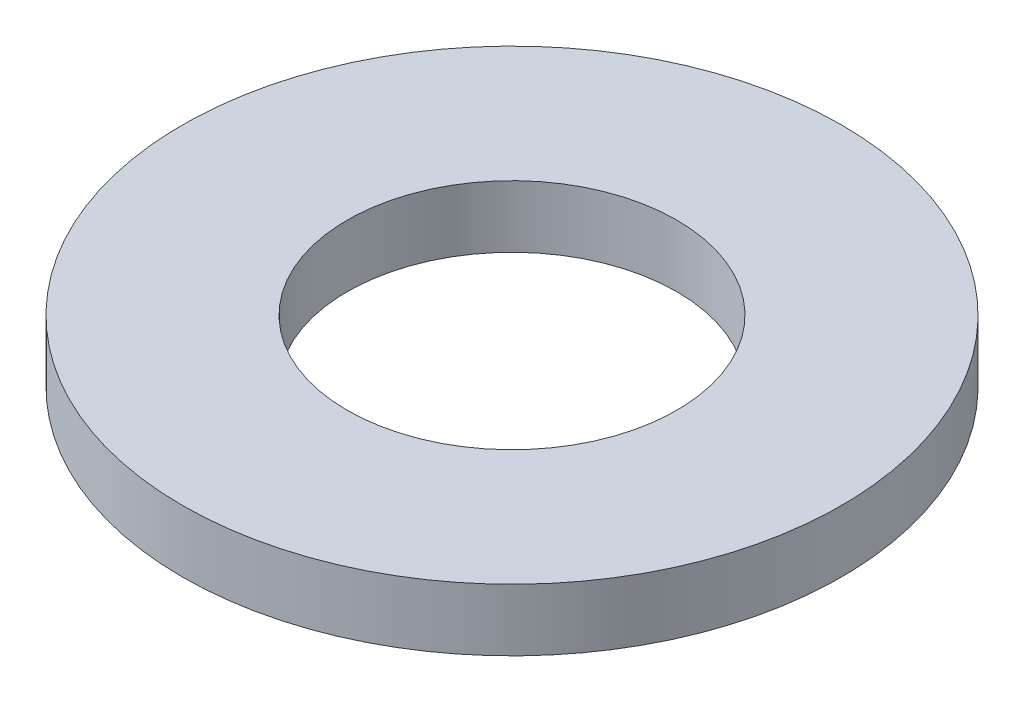
from build123d import *

# Parameters (mm, degrees)
SKETCH1_R           = 85
BOSS_EXTRUDE1_DEPTH = 16
SKETCH2_R           = 42.5
CUT_EXTRUDE1_DEPTH  = 122.268297588


with BuildPart() as part:
    # Sketch1 → Boss-Extrude1 (new body)
    with BuildSketch(Plane(origin=(0, 0, 0), x_dir=(1, 0, 0), z_dir=(0, 1, 0))):
        Circle(SKETCH1_R)
    extrude(amount=BOSS_EXTRUDE1_DEPTH)

    # Sketch2 → Cut-Extrude1 (cut, through all)
    with BuildSketch(Plane(origin=(0, 0, 0), x_dir=(1, 0, 0), z_dir=(0, 1, 0))):
        Circle(SKETCH2_R)
    extrude(amount=CUT_EXTRUDE1_DEPTH, mode=Mode.SUBTRACT)


solid = part.part
